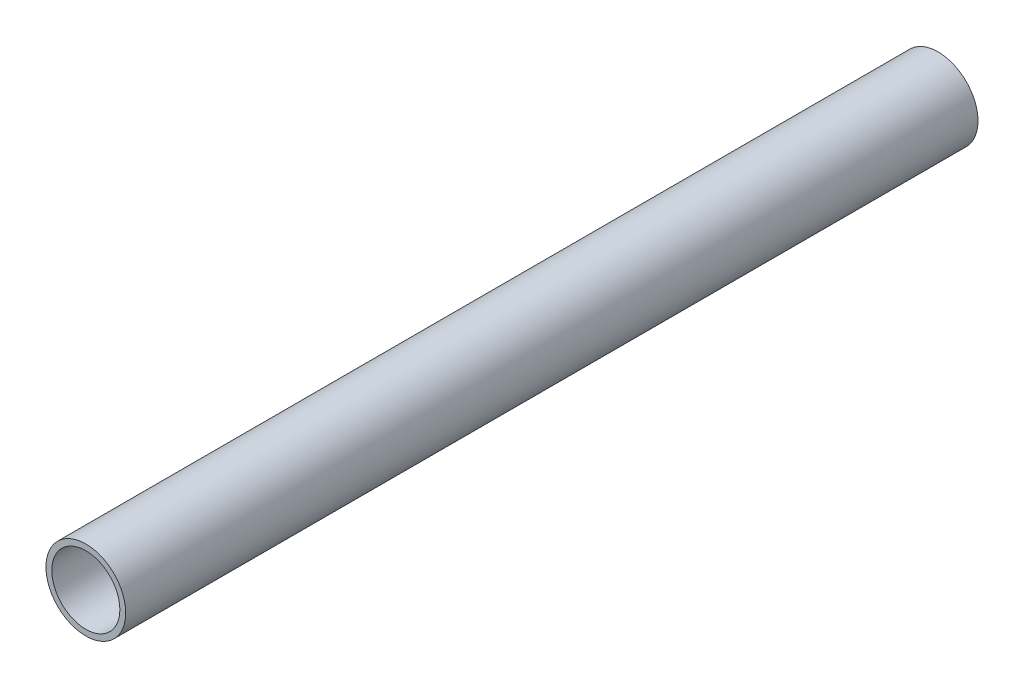
from build123d import *

# Parameters (mm, degrees)
SKETCH1_R      = 9.36
SKETCH1_R_2    = 7.99
EXTRUDE1_DEPTH = 200


with BuildPart() as part:
    # Sketch1 → Extrude1 (new body)
    with BuildSketch(Plane.XY):
        Circle(SKETCH1_R)
        Circle(SKETCH1_R_2, mode=Mode.SUBTRACT)
    extrude(amount=EXTRUDE1_DEPTH)


solid = part.part
